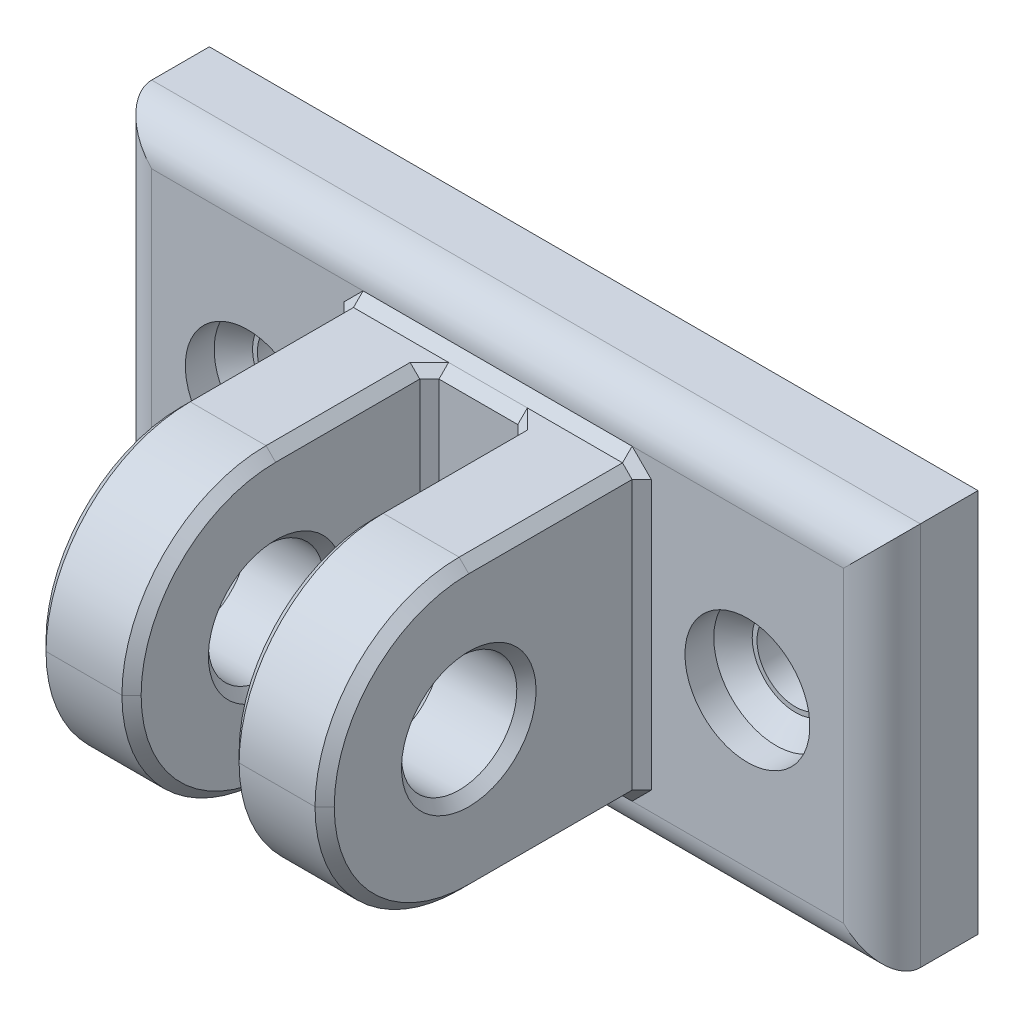
from build123d import *

# Parameters (mm, degrees)
SKETCH1_W               = 40
SKETCH1_H               = 20
BOSS_EXTRUDE1_DEPTH     = 5
SKETCH2_W               = 4.95
SKETCH2_H               = 15
BOSS_EXTRUDE2_DEPTH     = 16.5
CUT_EXTRUDE1_DEPTH      = 37.311155311
CUT_EXTRUDE1_DEPTH_BACK = 37.311155311
SKETCH3_R               = 3
FILLET1_R               = 7.5
SKETCH4_W               = 5.1
SKETCH4_H               = 15
BOSS_EXTRUDE3_DEPTH     = 1
CHAMFER1_SIZE           = 0.5
FILLET2_R               = 2
CUT_EXTRUDE2_DEPTH      = 28.789386463
CUT_EXTRUDE2_DEPTH_BACK = 28.789386463
SKETCH5_R               = 2
SKETCH7_R               = 3.25
CUT_EXTRUDE3_DEPTH      = 2.5
CHAMFER2_SIZE           = 1


with BuildPart() as part:
    # Sketch1 → Boss-Extrude1 (new body)
    with BuildSketch(Plane.XY):
        Rectangle(SKETCH1_W, SKETCH1_H)
    extrude(amount=BOSS_EXTRUDE1_DEPTH)

    # Sketch2 → Boss-Extrude2 (add)
    with BuildSketch(Plane.XY.offset(5)):
        with Locations((-5.025, 0)):
            Rectangle(SKETCH2_W, SKETCH2_H)
        with Locations((5.025, 0)):
            Rectangle(SKETCH2_W, SKETCH2_H)
    extrude(amount=BOSS_EXTRUDE2_DEPTH)

    # Sketch3 → Cut-Extrude1 (cut, two sides: drawn at the far end of the back side and taken through both)
    with BuildSketch(Plane.ZY.offset(7.5).offset(-CUT_EXTRUDE1_DEPTH_BACK)):
        with Locations(Location((14, 0, 0), (0, 0, 270))):
            Circle(SKETCH3_R)
    extrude(amount=CUT_EXTRUDE1_DEPTH + CUT_EXTRUDE1_DEPTH_BACK, mode=Mode.SUBTRACT)

    # Fillet1
    fillet1_edges = [part.edges().sort_by_distance(p)[0] for p in [
        (5.025, -7.5, 21.5),
        (5.025, 7.5, 21.5),
        (-5.025, -7.5, 21.5),
        (-5.025, 7.5, 21.5),
    ]]
    fillet(fillet1_edges, radius=FILLET1_R - 0.0001)  # a hair under: the kernel refuses the full size

    # Sketch4 → Boss-Extrude3 (add)
    with BuildSketch(Plane.XY.offset(5)):
        Rectangle(SKETCH4_W, SKETCH4_H)
    extrude(amount=BOSS_EXTRUDE3_DEPTH)

    # Chamfer1
    chamfer1_edges = [part.edges().sort_by_distance(p)[0] for p in [
        (0, 7.5, 5),
        (-7.5, 0, 5),
        (0, -7.5, 5),
        (7.5, 0, 5),
        (-7.5, 3, 14),
        (-2.55, 3, 14),
        (2.55, 3, 14),
        (7.5, 3, 14),
        (7.5, 7.5, 9.50005),
        (7.5, -7.5, 9.50005),
        (7.5, 5.303330148, 19.303330148),
        (7.5, -5.303330148, 19.303330148),
        (2.55, -7.5, 10.00005),
        (2.55, 7.5, 10.00005),
        (2.55, 5.303330148, 19.303330148),
        (2.55, -5.303330148, 19.303330148),
        (-2.55, 7.5, 10.00005),
        (-2.55, -7.5, 10.00005),
        (-2.55, 5.303330148, 19.303330148),
        (-2.55, -5.303330148, 19.303330148),
        (-7.5, -7.5, 9.50005),
        (-7.5, 7.5, 9.50005),
        (-7.5, 5.303330148, 19.303330148),
        (-7.5, -5.303330148, 19.303330148),
        (2.55, 0, 6),
        (0, 7.5, 6),
        (-2.55, 0, 6),
        (0, -7.5, 6),
    ]]
    chamfer(chamfer1_edges, length=CHAMFER1_SIZE - 0.0001)  # a hair under: the kernel refuses the full size

    # Fillet2
    fillet2_edges = [part.edges().sort_by_distance(p)[0] for p in [
        (20, 0, 5),
        (0, 10, 5),
        (-20, 0, 5),
        (0, -10, 5),
    ]]
    fillet(fillet2_edges, radius=FILLET2_R)

    # Sketch5 → Cut-Extrude2 (cut, two sides: drawn at the far end of the back side and taken through both)
    with BuildSketch(Plane.XY.offset(5).offset(-CUT_EXTRUDE2_DEPTH_BACK)):
        with Locations((-13, 0)):
            Circle(SKETCH5_R)
        with Locations(Location((13, 0, 0), (0, 0, 180))):
            Circle(SKETCH5_R)
    extrude(amount=CUT_EXTRUDE2_DEPTH + CUT_EXTRUDE2_DEPTH_BACK, mode=Mode.SUBTRACT)

    # Sketch7 → Cut-Extrude3 (cut)
    with BuildSketch(Plane.XY.offset(5)):
        with Locations((-13, 0)):
            Circle(SKETCH7_R)
        with Locations(Location((13, 0, 0), (0, 0, 180))):
            Circle(SKETCH7_R)
    extrude(amount=-CUT_EXTRUDE3_DEPTH, mode=Mode.SUBTRACT)

    # Chamfer2
    chamfer2_edges = [part.edges().sort_by_distance(p)[0] for p in [
        (-16.25, 0, 2.5),
        (16.25, 0, 2.5),
    ]]
    chamfer(chamfer2_edges, length=CHAMFER2_SIZE)


solid = part.part
